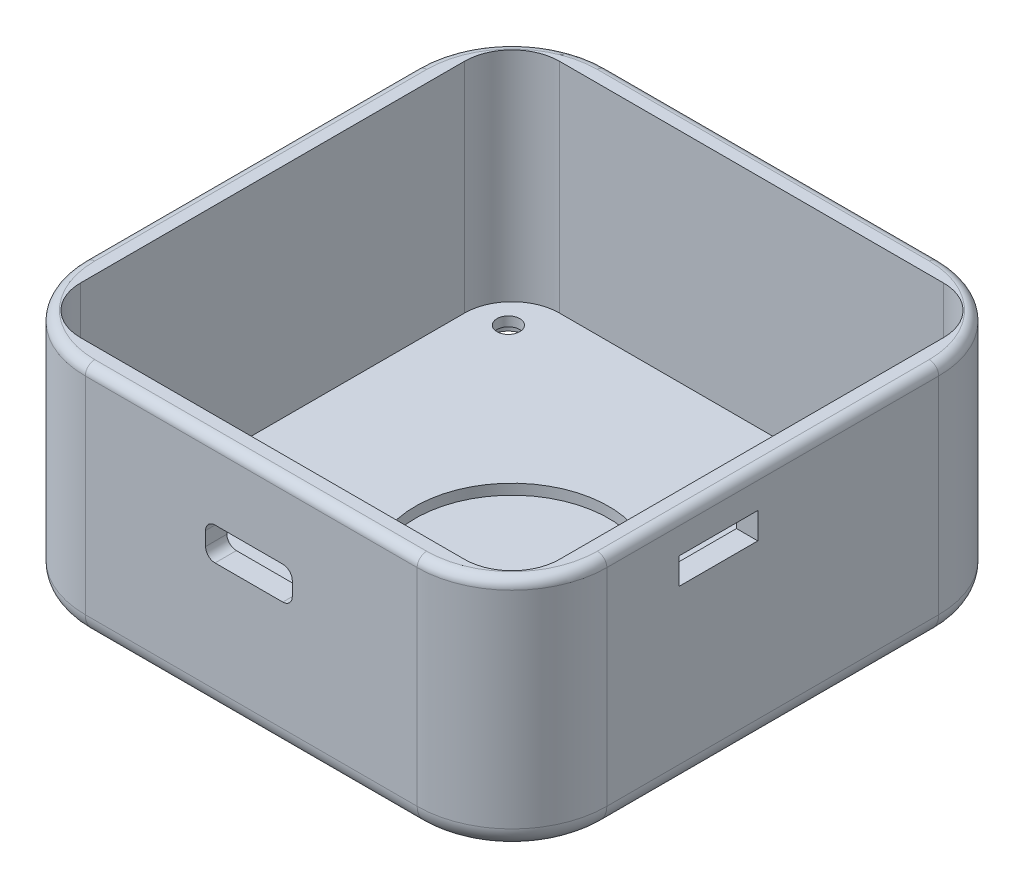
from build123d import *

# Parameters (mm, degrees)
EXTRUDE_2_DEPTH      = 25
CUT_EXTRUDE_1_DEPTH  = 23
SKETCH_4_R           = 1.2
CUT_EXTRUDE_2_DEPTH  = 10
SKETCH_5_R           = 2.05
CUT_EXTRUDE_3_DEPTH  = 1
CUT_EXTRUDE_4_DEPTH  = 8
SKETCH_8_W           = 8.296155167
SKETCH_8_H           = 2.779340605
CUT_EXTRUDE_9_DEPTH  = 8
SKETCH_11_R          = 10.2
CUT_EXTRUDE_11_DEPTH = 1.1
FILLET_3_R           = 2.2
FILLET_4_R           = 1


with BuildPart() as part:
    # 草图1 → 凸台-拉伸2 (new body)
    with BuildSketch(Plane(origin=(0, 0, 0), x_dir=(1, 0, 0), z_dir=(0, 1, 0))):
        with BuildLine():
            Line((-17.5, 27.5), (17.5, 27.5))
            ThreePointArc((17.5, 27.5), (24.571067812, 24.571067812), (27.5, 17.5))
            Line((27.5, 17.5), (27.5, -17.5))
            ThreePointArc((27.5, -17.5), (24.571067812, -24.571067812), (17.5, -27.5))
            Line((17.5, -27.5), (-17.5, -27.5))
            ThreePointArc((-17.5, -27.5), (-24.571067812, -24.571067812), (-27.5, -17.5))
            Line((-27.5, -17.5), (-27.5, 17.5))
            ThreePointArc((-27.5, 17.5), (-24.571067812, 24.571067812), (-17.5, 27.5))
        make_face()
    extrude(amount=EXTRUDE_2_DEPTH)

    # 草图3 → 切除-拉伸1 (cut)
    with BuildSketch(Plane(origin=(0, 25, 0), x_dir=(1, 0, 0), z_dir=(0, 1, 0))):
        with BuildLine():
            Line((-20.25, 25.25), (20.25, 25.25))
            ThreePointArc((20.25, 25.25), (23.785533906, 23.785533906), (25.25, 20.25))
            Line((25.25, 20.25), (25.25, -20.25))
            ThreePointArc((25.25, -20.25), (23.785533906, -23.785533906), (20.25, -25.25))
            Line((20.25, -25.25), (-20.25, -25.25))
            ThreePointArc((-20.25, -25.25), (-23.785533906, -23.785533906), (-25.25, -20.25))
            Line((-25.25, -20.25), (-25.25, 20.25))
            ThreePointArc((-25.25, 20.25), (-23.785533906, 23.785533906), (-20.25, 25.25))
        make_face()
    extrude(amount=-CUT_EXTRUDE_1_DEPTH, mode=Mode.SUBTRACT)

    # 草图4 → 切除-拉伸2 (cut)
    with BuildSketch(Plane.XZ):
        with Locations(Location((-21.452692405, 21.308392177, 0), (0, 0, 270))):
            Circle(SKETCH_4_R)
        with Locations(Location((21.308392177, 20.927391415, 0), (0, 0, 270))):
            Circle(SKETCH_4_R)
        with Locations(Location((-21.833693167, -21.452692405, 0), (0, 0, 270))):
            Circle(SKETCH_4_R)
        with Locations(Location((20.927391415, -21.833693167, 0), (0, 0, 270))):
            Circle(SKETCH_4_R)
    extrude(amount=-CUT_EXTRUDE_2_DEPTH, mode=Mode.SUBTRACT)

    # 草图5 → 切除-拉伸3 (cut)
    with BuildSketch(Plane.XZ):
        with Locations(Location((-21.452692405, 21.308392177, 0), (0, 0, 270))):
            Circle(SKETCH_5_R)
        with Locations(Location((21.308392177, 20.927391415, 0), (0, 0, 270))):
            Circle(SKETCH_5_R)
        with Locations(Location((-21.833693167, -21.452692405, 0), (0, 0, 270))):
            Circle(SKETCH_5_R)
        with Locations(Location((20.927391415, -21.833693167, 0), (0, 0, 270))):
            Circle(SKETCH_5_R)
    extrude(amount=-CUT_EXTRUDE_3_DEPTH, mode=Mode.SUBTRACT)

    # 草图7 → 切除-拉伸4 (cut)
    with BuildSketch(Plane.XY.offset(27.5)):
        with BuildLine():
            Line((-3.815614102, 17.230683857), (3.328314128, 17.230683857))
            ThreePointArc((3.328314128, 17.230683857), (4.035420909, 16.937790638), (4.328314128, 16.230683857))
            Line((4.328314128, 16.230683857), (4.328314128, 14.769316156))
            ThreePointArc((4.328314128, 14.769316156), (4.035420909, 14.062209375), (3.328314128, 13.769316156))
            Line((3.328314128, 13.769316156), (-3.815614102, 13.769316156))
            ThreePointArc((-3.815614102, 13.769316156), (-4.522720884, 14.062209375), (-4.815614102, 14.769316156))
            Line((-4.815614102, 14.769316156), (-4.815614102, 16.230683857))
            ThreePointArc((-4.815614102, 16.230683857), (-4.522720884, 16.937790638), (-3.815614102, 17.230683857))
        make_face()
    extrude(amount=-CUT_EXTRUDE_4_DEPTH, mode=Mode.SUBTRACT)

    # 草图8 → 切除-拉伸9 (cut)
    with BuildSketch(Plane(origin=(27.5, 0, 0), x_dir=(0, 0, -1), z_dir=(1, 0, 0))):
        with Locations((-5.725361951, 19.869366797)):
            Rectangle(SKETCH_8_W, SKETCH_8_H)
    extrude(amount=-CUT_EXTRUDE_9_DEPTH, mode=Mode.SUBTRACT)

    # 草图11 → 切除-拉伸11 (cut)
    with BuildSketch(Plane(origin=(0, 2, 0), x_dir=(1, 0, 0), z_dir=(0, 1, 0))):
        with Locations(Location((0, 0, 0), (0, 0, 270))):
            Circle(SKETCH_11_R)
    extrude(amount=-CUT_EXTRUDE_11_DEPTH, mode=Mode.SUBTRACT)

    # 圆角3
    # the kernel refuses this fillet: 2.2 mm, written as the material it takes off along each edge
    with BuildSketch(Plane(origin=(17.5, 0, 27.5), x_dir=(0, 0, -1), z_dir=(-1, 0, 0)), Plane(origin=(-27.5, 0, 17.5), x_dir=(1, 0, 0), z_dir=(0, 0, -1)), Plane(origin=(27.5, 0, -17.5), x_dir=(-1, 0, 0), z_dir=(0, 0, 1))) as fillet_3_piece_1:
        with BuildLine():
            CenterArc((FILLET_3_R, -FILLET_3_R), FILLET_3_R, 90, 90)
            Line((0, -FILLET_3_R), (0, 0))
            Line((0, 0), (FILLET_3_R, 0))
        make_face()
    extrude(amount=35, mode=Mode.SUBTRACT)
    with BuildSketch(Plane(origin=(-17.5, 0, 17.5), x_dir=(0, 0, 1), z_dir=(1, 0, 0))) as fillet_3_piece_2:
        with BuildLine():
            CenterArc((10 - FILLET_3_R, -FILLET_3_R), FILLET_3_R, 0, 90)
            Line((10, -FILLET_3_R), (10, 0))
            Line((10, 0), (10 - FILLET_3_R, 0))
        make_face()
    revolve(axis=Axis((-17.5, 0, 17.5), (0, -1, 0)), revolution_arc=90, mode=Mode.SUBTRACT)
    with BuildSketch(Plane(origin=(-17.5, 0, -17.5), x_dir=(-1, 0, 0), z_dir=(0, 0, 1))) as fillet_3_piece_3:
        with BuildLine():
            CenterArc((10 - FILLET_3_R, -FILLET_3_R), FILLET_3_R, 0, 90)
            Line((10 - FILLET_3_R, 0), (10, 0))
            Line((10, 0), (10, -FILLET_3_R))
        make_face()
    revolve(axis=Axis((-17.5, 0, -17.5), (0, -1, 0)), revolution_arc=90, mode=Mode.SUBTRACT)
    with BuildSketch(Plane(origin=(-17.5, 0, -27.5), x_dir=(0, 1, 0), z_dir=(1, 0, 0))) as fillet_3_piece_4:
        with BuildLine():
            CenterArc((FILLET_3_R, FILLET_3_R), FILLET_3_R, 180, 90)
            Line((0, FILLET_3_R), (0, 0))
            Line((0, 0), (FILLET_3_R, 0))
        make_face()
    extrude(amount=35, mode=Mode.SUBTRACT)
    with BuildSketch(Plane(origin=(17.5, 0, -17.5), x_dir=(0, 0, -1), z_dir=(-1, 0, 0))) as fillet_3_piece_5:
        with BuildLine():
            CenterArc((10 - FILLET_3_R, -FILLET_3_R), FILLET_3_R, 0, 90)
            Line((10 - FILLET_3_R, 0), (10, 0))
            Line((10, 0), (10, -FILLET_3_R))
        make_face()
    revolve(axis=Axis((17.5, 0, -17.5), (0, -1, 0)), revolution_arc=90, mode=Mode.SUBTRACT)
    with BuildSketch(Plane(origin=(17.5, 0, 17.5), x_dir=(1, 0, 0), z_dir=(0, 0, -1))) as fillet_3_piece_6:
        with BuildLine():
            CenterArc((10 - FILLET_3_R, -FILLET_3_R), FILLET_3_R, 0, 90)
            Line((10, -FILLET_3_R), (10, 0))
            Line((10, 0), (10 - FILLET_3_R, 0))
        make_face()
    revolve(axis=Axis((17.5, 0, 17.5), (0, -1, 0)), revolution_arc=90, mode=Mode.SUBTRACT)

    # 圆角4
    fillet_4_edges = [part.edges().sort_by_distance(p)[0] for p in [
        (-24.571067812, 25, 24.571067812),
        (0, 25, 27.5),
        (24.571067812, 25, 24.571067812),
        (27.5, 25, 0),
        (24.571067812, 25, -24.571067812),
        (0, 25, -27.5),
        (-24.571067812, 25, -24.571067812),
        (-27.5, 25, 0),
    ]]
    fillet(fillet_4_edges, radius=FILLET_4_R)


solid = part.part
